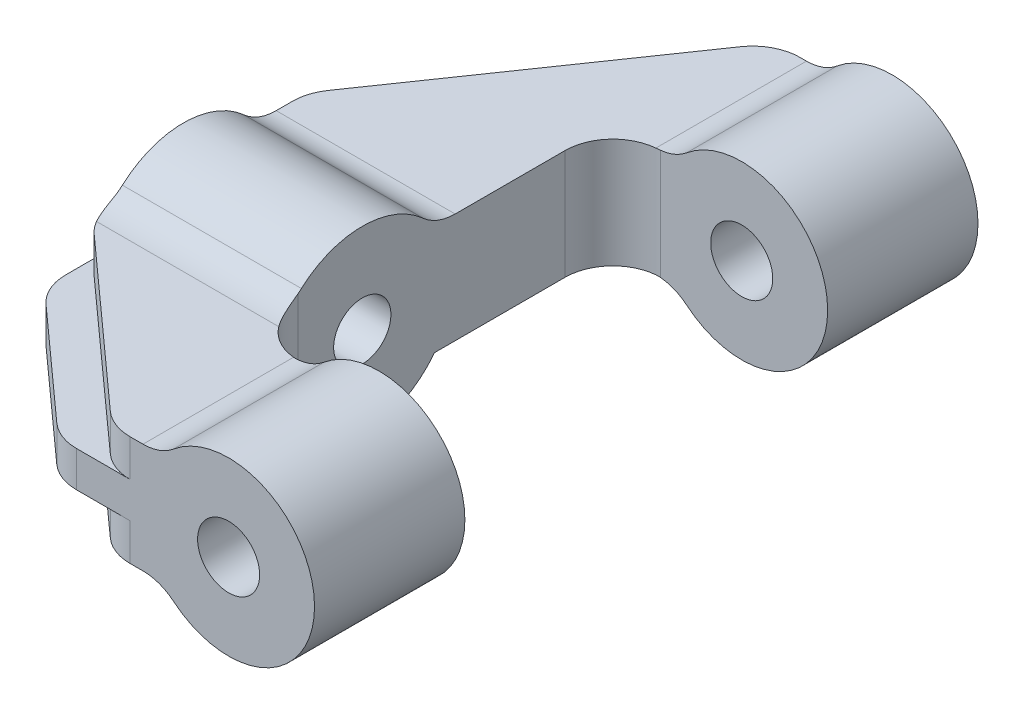
from build123d import *

# Parameters (mm, degrees)
BOSS_EXTRUDE1_DEPTH      = 2.3
BOSS_EXTRUDE1_DEPTH_BACK = 2.3
BOSS_EXTRUDE2_DEPTH      = 0.75
BOSS_EXTRUDE2_DEPTH_BACK = 0.75
FILLET1_R                = 2
FILLET2_R                = 2


with BuildPart() as part:
    # Sketch1 → Revolve1 (revolve)
    with BuildSketch(Plane(origin=(0, 0, 0), x_dir=(1, 0, 0), z_dir=(0, 1, 0))):
        Polygon((1.3, 16.8), (3.5999999999999996, 16.8), (3.6, 10.500000000000002), (1.2999999999999974, 10.500000000000002), align=None)
        Polygon((1.2999999999999996, -4.7), (1.3000000000000003, -11), (3.600000000000003, -11), (3.600000000000003, -4.699999999999999), align=None)
    revolve(axis=Axis((0, 0, 15.034923930772436), (0, 0, -1)))



with BuildPart() as body_2:
    # Sketch3 → Revolve2 (revolve)
    with BuildSketch(Plane(origin=(0, 0, 0), x_dir=(1, 0, 0), z_dir=(0, 1, 0))):
        Polygon((-12.899999999999995, 3.7999999999999985), (-12.899999999999995, 1.1999999999999975), (-5.399999999999995, 1.1999999999999975), (-5.399999999999996, 3.7999999999999994), align=None)
    revolve(axis=Axis((0, 0, 0), (-1, 0, 0)))


with BuildPart() as part_1:
    add(part.part)

    add(body_2.part)  # Boss-Extrude1 merges body 2
    # Sketch4 → Boss-Extrude1 (add, two sides: drawn at the far end of the back side and taken through both)
    with BuildSketch(Plane(origin=(0, 0, 0), x_dir=(1, 0, 0), z_dir=(0, 1, 0)).offset(-BOSS_EXTRUDE1_DEPTH_BACK)):
        Polygon((-1.3, -4.699999999999999), (-5.399999999999995, -4.699999999999999), (-5.399999999999995, -1.1999999999999975), (-12.899999999999995, -1.1999999999999975), (-12.899999999999986, -3.799999999999999), (-4.899999999999998, -11), (-1.3, -11), align=None)
        Polygon((-5.399999999999995, 1.1999999999999975), (-5.399999999999995, 10.500000000000002), (-1.2999999999999987, 10.500000000000002), (-1.2999999999999987, 16.8), (-4.899999999999998, 16.8), (-12.899999999999995, 5.199999999999998), (-12.899999999999995, 1.1999999999999975), align=None)
    extrude(amount=BOSS_EXTRUDE1_DEPTH + BOSS_EXTRUDE1_DEPTH_BACK)

    # Sketch5 → Boss-Extrude2 (add, two sides: drawn at the far end of the back side and taken through both)
    with BuildSketch(Plane(origin=(0, 0, 0), x_dir=(1, 0, 0), z_dir=(0, 1, 0)).offset(-BOSS_EXTRUDE2_DEPTH_BACK)):
        Polygon((-12.899999999999995, 5.199999999999998), (-12.899999999999995, 7.84208724307128), (-6.722129133152607, 16.8), (-4.899999999999998, 16.8), align=None)
        Polygon((-4.899999999999998, -11), (-7.142270674512282, -11), (-12.899999999999986, -5.818043607061059), (-12.899999999999986, -3.799999999999999), align=None)
    extrude(amount=BOSS_EXTRUDE2_DEPTH + BOSS_EXTRUDE2_DEPTH_BACK)

    # Fillet1
    fillet1_edges = [part_1.edges().sort_by_distance(p)[0] for p in [
        (-7.142270674512282, 0, 11),
        (-12.899999999999986, 0, 5.818043607061059),
        (-6.722129133152607, 0, -16.8),
        (-12.899999999999995, 0, -7.84208724307128),
        (-12.899999999999995, 1.525, -5.199999999999998),
        (-12.899999999999995, -1.525, -5.199999999999998),
        (-12.899999999999986, -1.525, 3.799999999999999),
        (-12.899999999999986, 1.525, 3.799999999999999),
        (-4.899999999999998, -1.525, 11),
        (-4.899999999999998, 1.525, 11),
        (-4.899999999999998, -1.525, -16.8),
        (-4.899999999999998, 1.525, -16.8),
        (-5.399999999999995, 0, 4.699999999999999),
        (-5.399999999999995, 0, -10.500000000000002),
    ]]
    fillet(fillet1_edges, radius=FILLET1_R)

    # Fillet2
    fillet2_edges = [part_1.edges().sort_by_distance(p)[0] for p in [
        (-2.7694764848252498, 2.3, 7.85),
    ]]
    fillet(fillet2_edges, radius=FILLET2_R)
    fillet2_2_edges = [part_1.edges().sort_by_distance(p)[0] for p in [
        (-9.13504460902135, 2.3, 3.024896692450834),
    ]]
    fillet(fillet2_2_edges, radius=FILLET2_R)
    fillet2_3_edges = [part_1.edges().sort_by_distance(p)[0] for p in [
        (-2.7694764848252498, -2.3, 7.85),
    ]]
    fillet(fillet2_3_edges, radius=FILLET2_R)
    fillet2_4_edges = [part_1.edges().sort_by_distance(p)[0] for p in [
        (-2.7694764848252453, -2.3, -13.65),
    ]]
    fillet(fillet2_4_edges, radius=FILLET2_R)
    fillet2_5_edges = [part_1.edges().sort_by_distance(p)[0] for p in [
        (-2.7694764848252453, 2.3, -13.65),
    ]]
    fillet(fillet2_5_edges, radius=FILLET2_R)
    fillet2_6_edges = [part_1.edges().sort_by_distance(p)[0] for p in [
        (-9.149999999999995, 2.3, -3.024896692450834),
    ]]
    fillet(fillet2_6_edges, radius=FILLET2_R)


solid = part_1.part
